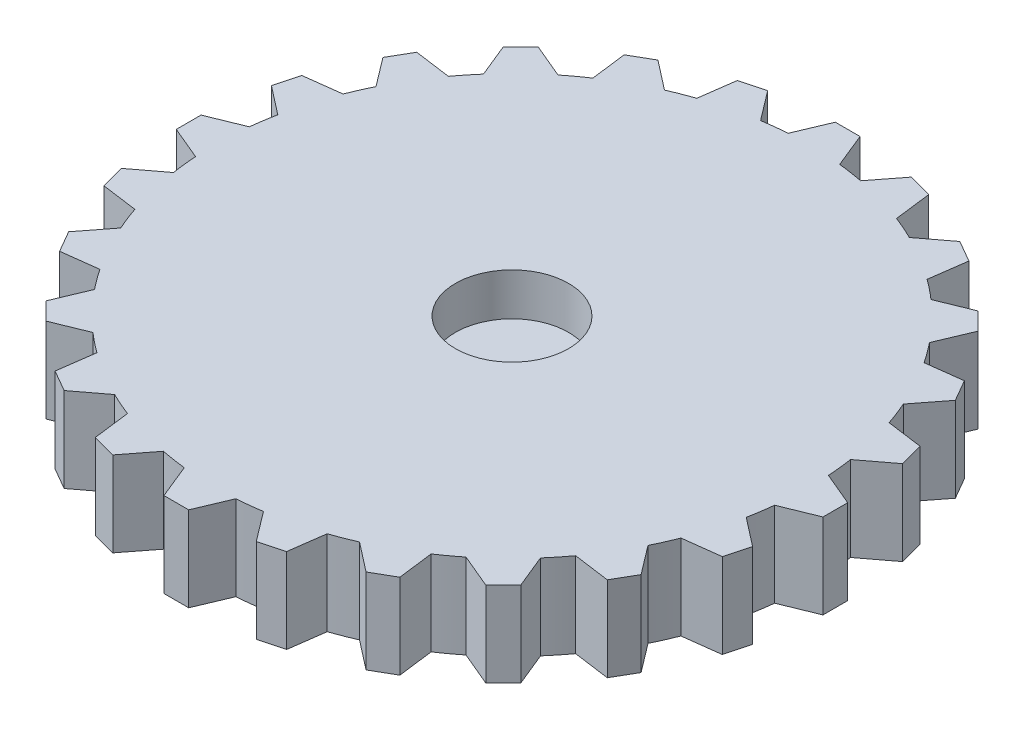
from build123d import *

# Parameters (mm, degrees)
BOSS_EXTRUDE5_DEPTH = 6
BOSS_EXTRUDE6_DEPTH = 3
SKETCH4_R           = 4
CUT_EXTRUDE1_DEPTH  = 10


with BuildPart() as part:
    # Sketch3 → Boss-Extrude5 (new body)
    with BuildSketch(Plane(origin=(0, 0, 0), x_dir=(1, 0, 0), z_dir=(0, 1, 0))):
        with BuildLine():
            Line((20.873667622, -2.3), (23.301465589, -1.311541929))
            Line((23.301465589, -1.311541929), (23.301465589, 0.438458071))
            Line((23.301465589, 0.438458071), (20.951465589, 1.426916143))
            ThreePointArc((20.951465589, 1.426916143), (20.873013262, 2.30593091), (20.757698449, 3.180873321))
            Line((20.757698449, 3.180873321), (22.846939432, 4.764010852))
            Line((22.846939432, 4.764010852), (22.394006103, 6.454381048))
            Line((22.394006103, 6.454381048), (19.868248637, 6.800933471))
            ThreePointArc((19.868248637, 6.800933471), (19.564963746, 7.629691581), (19.227126431, 8.444975382))
            Line((19.227126431, 8.444975382), (20.83543211, 10.514904166))
            Line((20.83543211, 10.514904166), (19.96043211, 12.030448623))
            Line((19.96043211, 12.030448623), (17.431043375, 11.711478423))
            ThreePointArc((17.431043375, 11.711478423), (16.923594283, 12.433501379), (16.386257521, 13.133566327))
            Line((16.386257521, 13.133566327), (17.404024521, 15.549224138))
            Line((17.404024521, 15.549224138), (16.166587654, 16.786661005))
            Line((16.166587654, 16.786661005), (13.805941313, 15.823905474))
            ThreePointArc((13.805941313, 15.823905474), (13.128909838, 16.389988605), (12.42869224, 16.927126431))
            Line((12.42869224, 16.927126431), (12.786561423, 19.523890181))
            Line((12.786561423, 19.523890181), (11.271016966, 20.398890181))
            Line((11.271016966, 20.398890181), (9.239987166, 18.857959518))
            ThreePointArc((9.239987166, 18.857959518), (8.439511883, 19.229525194), (7.624132122, 19.567130842))
            Line((7.624132122, 19.567130842), (7.297715294, 22.168035373))
            Line((7.297715294, 22.168035373), (5.607345098, 22.620968702))
            Line((5.607345098, 22.620968702), (4.044343163, 20.606874784))
            ThreePointArc((4.044343163, 20.606874784), (3.174975141, 20.758601419), (2.3, 20.873667622))
            Line((2.3, 20.873667622), (1.311541929, 23.301465589))
            Line((1.311541929, 23.301465589), (-0.438458071, 23.301465589))
            Line((-0.438458071, 23.301465589), (-1.426916143, 20.951465589))
            ThreePointArc((-1.426916143, 20.951465589), (-2.30593091, 20.873013262), (-3.180873321, 20.757698449))
            Line((-3.180873321, 20.757698449), (-4.764010852, 22.846939432))
            Line((-4.764010852, 22.846939432), (-6.454381048, 22.394006103))
            Line((-6.454381048, 22.394006103), (-6.800933471, 19.868248637))
            ThreePointArc((-6.800933471, 19.868248637), (-7.629691581, 19.564963746), (-8.444975382, 19.227126431))
            Line((-8.444975382, 19.227126431), (-10.514904166, 20.83543211))
            Line((-10.514904166, 20.83543211), (-12.030448623, 19.96043211))
            Line((-12.030448623, 19.96043211), (-11.711478423, 17.431043375))
            ThreePointArc((-11.711478423, 17.431043375), (-12.433501379, 16.923594283), (-13.133566327, 16.386257521))
            Line((-13.133566327, 16.386257521), (-15.549224138, 17.404024521))
            Line((-15.549224138, 17.404024521), (-16.786661005, 16.166587654))
            Line((-16.786661005, 16.166587654), (-15.823905474, 13.805941313))
            ThreePointArc((-15.823905474, 13.805941313), (-16.389988605, 13.128909838), (-16.927126431, 12.42869224))
            Line((-16.927126431, 12.42869224), (-19.523890181, 12.786561423))
            Line((-19.523890181, 12.786561423), (-20.398890181, 11.271016966))
            Line((-20.398890181, 11.271016966), (-18.857959518, 9.239987166))
            ThreePointArc((-18.857959518, 9.239987166), (-19.229525194, 8.439511883), (-19.567130842, 7.624132122))
            Line((-19.567130842, 7.624132122), (-22.168035373, 7.297715294))
            Line((-22.168035373, 7.297715294), (-22.620968702, 5.607345098))
            Line((-22.620968702, 5.607345098), (-20.606874784, 4.044343163))
            ThreePointArc((-20.606874784, 4.044343163), (-20.758601419, 3.174975141), (-20.873667622, 2.3))
            Line((-20.873667622, 2.3), (-23.301465589, 1.311541929))
            Line((-23.301465589, 1.311541929), (-23.301465589, -0.438458071))
            Line((-23.301465589, -0.438458071), (-20.951465589, -1.426916143))
            ThreePointArc((-20.951465589, -1.426916143), (-20.873013262, -2.30593091), (-20.757698449, -3.180873321))
            Line((-20.757698449, -3.180873321), (-22.846939432, -4.764010852))
            Line((-22.846939432, -4.764010852), (-22.394006103, -6.454381048))
            Line((-22.394006103, -6.454381048), (-19.868248637, -6.800933471))
            ThreePointArc((-19.868248637, -6.800933471), (-19.564963746, -7.629691581), (-19.227126431, -8.444975382))
            Line((-19.227126431, -8.444975382), (-20.83543211, -10.514904166))
            Line((-20.83543211, -10.514904166), (-19.96043211, -12.030448623))
            Line((-19.96043211, -12.030448623), (-17.431043375, -11.711478423))
            ThreePointArc((-17.431043375, -11.711478423), (-16.923594283, -12.433501379), (-16.386257521, -13.133566327))
            Line((-16.386257521, -13.133566327), (-17.404024521, -15.549224138))
            Line((-17.404024521, -15.549224138), (-16.166587654, -16.786661005))
            Line((-16.166587654, -16.786661005), (-13.805941313, -15.823905474))
            ThreePointArc((-13.805941313, -15.823905474), (-13.128909838, -16.389988605), (-12.42869224, -16.927126431))
            Line((-12.42869224, -16.927126431), (-12.786561423, -19.523890181))
            Line((-12.786561423, -19.523890181), (-11.271016966, -20.398890181))
            Line((-11.271016966, -20.398890181), (-9.239987166, -18.857959518))
            ThreePointArc((-9.239987166, -18.857959518), (-8.439511883, -19.229525194), (-7.624132122, -19.567130842))
            Line((-7.624132122, -19.567130842), (-7.297715294, -22.168035373))
            Line((-7.297715294, -22.168035373), (-5.607345098, -22.620968702))
            Line((-5.607345098, -22.620968702), (-4.044343163, -20.606874784))
            ThreePointArc((-4.044343163, -20.606874784), (-3.174975141, -20.758601419), (-2.3, -20.873667622))
            Line((-2.3, -20.873667622), (-1.311541929, -23.301465589))
            Line((-1.311541929, -23.301465589), (0.438458071, -23.301465589))
            Line((0.438458071, -23.301465589), (1.426916143, -20.951465589))
            ThreePointArc((1.426916143, -20.951465589), (2.30593091, -20.873013262), (3.180873321, -20.757698449))
            Line((3.180873321, -20.757698449), (4.764010852, -22.846939432))
            Line((4.764010852, -22.846939432), (6.454381048, -22.394006103))
            Line((6.454381048, -22.394006103), (6.800933471, -19.868248637))
            ThreePointArc((6.800933471, -19.868248637), (7.629691581, -19.564963746), (8.444975382, -19.227126431))
            Line((8.444975382, -19.227126431), (10.514904166, -20.83543211))
            Line((10.514904166, -20.83543211), (12.030448623, -19.96043211))
            Line((12.030448623, -19.96043211), (11.711478423, -17.431043375))
            ThreePointArc((11.711478423, -17.431043375), (12.433501379, -16.923594283), (13.133566327, -16.386257521))
            Line((13.133566327, -16.386257521), (15.549224138, -17.404024521))
            Line((15.549224138, -17.404024521), (16.786661005, -16.166587654))
            Line((16.786661005, -16.166587654), (15.823905474, -13.805941313))
            ThreePointArc((15.823905474, -13.805941313), (16.389988605, -13.128909838), (16.927126431, -12.42869224))
            Line((16.927126431, -12.42869224), (19.523890181, -12.786561423))
            Line((19.523890181, -12.786561423), (20.398890181, -11.271016966))
            Line((20.398890181, -11.271016966), (18.857959518, -9.239987166))
            ThreePointArc((18.857959518, -9.239987166), (19.229525194, -8.439511883), (19.567130842, -7.624132122))
            Line((19.567130842, -7.624132122), (22.168035373, -7.297715294))
            Line((22.168035373, -7.297715294), (22.620968702, -5.607345098))
            Line((22.620968702, -5.607345098), (20.606874784, -4.044343163))
            ThreePointArc((20.606874784, -4.044343163), (20.758601419, -3.174975141), (20.873667622, -2.3))
        make_face()
    extrude(amount=BOSS_EXTRUDE5_DEPTH)

    # Sketch4 → Cut-Extrude1 (cut)
    with BuildSketch(Plane(origin=(0, 6, 0), x_dir=(1, 0, 0), z_dir=(0, 1, 0))):
        Circle(SKETCH4_R)
    extrude(amount=-CUT_EXTRUDE1_DEPTH, mode=Mode.SUBTRACT)


with BuildPart() as body_2:
    # Sketch1 → Boss-Extrude6 (new body)
    with BuildSketch(Plane(origin=(0, 0, 0), x_dir=(1, 0, 0), z_dir=(0, 1, 0))):
        with BuildLine():
            Line((-0.5, 14.746169466), (0.5, 14.746169466))
            Line((0.5, 14.746169466), (2, 12.544128437))
            ThreePointArc((2, 12.544128437), (2.588190451, 12.405427729), (3.166928678, 12.23145084))
            Line((3.166928678, 12.23145084), (5.566987298, 13.388474311))
            Line((5.566987298, 13.388474311), (6.433012702, 12.888474311))
            Line((6.433012702, 12.888474311), (6.631030293, 10.23145084))
            ThreePointArc((6.631030293, 10.23145084), (7.071067812, 9.817237278), (7.485281374, 9.377199759))
            Line((7.485281374, 9.377199759), (10.142304845, 9.179182168))
            Line((10.142304845, 9.179182168), (10.642304845, 8.313156764))
            Line((10.642304845, 8.313156764), (9.485281374, 5.913098144))
            ThreePointArc((9.485281374, 5.913098144), (9.659258263, 5.334359917), (9.797958971, 4.746169466))
            Line((9.797958971, 4.746169466), (12, 3.246169466))
            Line((12, 3.246169466), (12, 2.246169466))
            Line((12, 2.246169466), (9.797958971, 0.746169466))
            ThreePointArc((9.797958971, 0.746169466), (9.659258263, 0.157979015), (9.485281374, -0.420759212))
            Line((9.485281374, -0.420759212), (10.642304845, -2.820817832))
            Line((10.642304845, -2.820817832), (10.142304845, -3.686843236))
            Line((10.142304845, -3.686843236), (7.485281374, -3.884860827))
            ThreePointArc((7.485281374, -3.884860827), (7.071067812, -4.324898346), (6.631030293, -4.739111908))
            Line((6.631030293, -4.739111908), (6.433012702, -7.39613538))
            Line((6.433012702, -7.39613538), (5.566987298, -7.89613538))
            Line((5.566987298, -7.89613538), (3.166928678, -6.739111908))
            ThreePointArc((3.166928678, -6.739111908), (2.588190451, -6.913088797), (2, -7.051789505))
            Line((2, -7.051789505), (0.5, -9.253830534))
            Line((0.5, -9.253830534), (-0.5, -9.253830534))
            Line((-0.5, -9.253830534), (-2, -7.051789505))
            ThreePointArc((-2, -7.051789505), (-2.588190451, -6.913088797), (-3.166928678, -6.739111908))
            Line((-3.166928678, -6.739111908), (-5.566987298, -7.89613538))
            Line((-5.566987298, -7.89613538), (-6.433012702, -7.39613538))
            Line((-6.433012702, -7.39613538), (-6.631030293, -4.739111908))
            ThreePointArc((-6.631030293, -4.739111908), (-7.071067812, -4.324898346), (-7.485281374, -3.884860827))
            Line((-7.485281374, -3.884860827), (-10.142304845, -3.686843236))
            Line((-10.142304845, -3.686843236), (-10.642304845, -2.820817832))
            Line((-10.642304845, -2.820817832), (-9.485281374, -0.420759212))
            ThreePointArc((-9.485281374, -0.420759212), (-9.659258263, 0.157979015), (-9.797958971, 0.746169466))
            Line((-9.797958971, 0.746169466), (-12, 2.246169466))
            Line((-12, 2.246169466), (-12, 3.246169466))
            Line((-12, 3.246169466), (-9.797958971, 4.746169466))
            ThreePointArc((-9.797958971, 4.746169466), (-9.659258263, 5.334359917), (-9.485281374, 5.913098144))
            Line((-9.485281374, 5.913098144), (-10.642304845, 8.313156764))
            Line((-10.642304845, 8.313156764), (-10.142304845, 9.179182168))
            Line((-10.142304845, 9.179182168), (-7.485281374, 9.377199759))
            ThreePointArc((-7.485281374, 9.377199759), (-7.071067812, 9.817237278), (-6.631030293, 10.23145084))
            Line((-6.631030293, 10.23145084), (-6.433012702, 12.888474311))
            Line((-6.433012702, 12.888474311), (-5.566987298, 13.388474311))
            Line((-5.566987298, 13.388474311), (-3.166928678, 12.23145084))
            ThreePointArc((-3.166928678, 12.23145084), (-2.588190451, 12.405427729), (-2, 12.544128437))
            Line((-2, 12.544128437), (-0.5, 14.746169466))
        make_face()
    extrude(amount=BOSS_EXTRUDE6_DEPTH)


solid = Compound([part.part, body_2.part])
